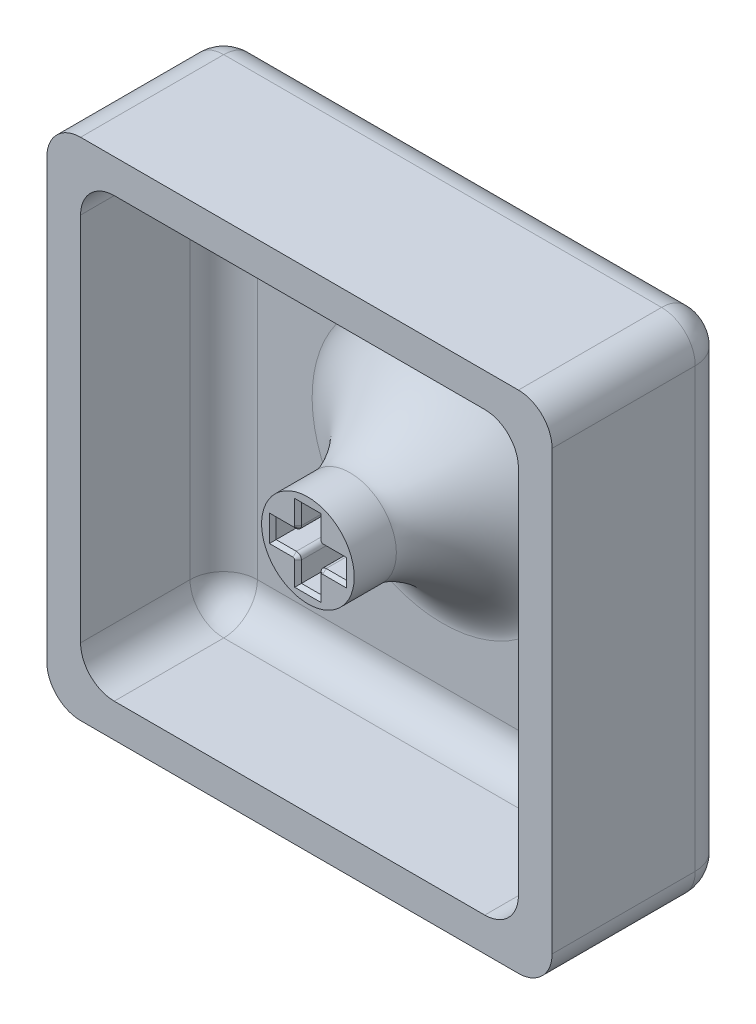
from build123d import *

# Parameters (mm, degrees)
EXTRUDE_1_DEPTH = 8.5
SKETCH_1_6_R    = 2.75
EXTRUDE_2_DEPTH = 8
EXTRUDE_START   = -2
EXTRUDE_3_DEPTH = 2
FILLET_4_R      = 0.3
FILLET_1_R      = 2
CHAMFER_1_SIZE  = 0.2
FILLET_2_R      = 2
FILLET_3_SIZE   = 5
FILLET_3_SIZE_2 = 5.5
EXTRUDE_START_2 = 4
EXTRUDE_4_DEPTH = 4


with BuildPart() as part:
    # 草图1 → 凸台-拉伸1 (new body)
    with BuildSketch(Plane.XY):
        with BuildLine():
            ThreePointArc((-15, 13), (-14.414213562, 14.414213562), (-13, 15))
            Line((-13, 15), (13, 15))
            ThreePointArc((13, 15), (14.414213562, 14.414213562), (15, 13))
            Line((15, 13), (15, -13))
            ThreePointArc((15, -13), (14.414213562, -14.414213562), (13, -15))
            Line((13, -15), (-13, -15))
            ThreePointArc((-13, -15), (-14.414213562, -14.414213562), (-15, -13))
            Line((-15, -13), (-15, 13))
        make_face()
        with BuildLine():
            ThreePointArc((-13, -11), (-12.414213562, -12.414213562), (-11, -13))
            Line((-11, -13), (11, -13))
            ThreePointArc((11, -13), (12.414213562, -12.414213562), (13, -11))
            Line((13, -11), (13, 11))
            ThreePointArc((13, 11), (12.414213562, 12.414213562), (11, 13))
            Line((11, 13), (-11, 13))
            ThreePointArc((-11, 13), (-12.414213562, 12.414213562), (-13, 11))
            Line((-13, 11), (-13, -11))
        make_face(mode=Mode.SUBTRACT)
    extrude(amount=EXTRUDE_1_DEPTH)



with BuildPart() as body_2:
    # 草图1<6> → 凸台-拉伸2 (new body)
    with BuildSketch(Plane.XY):
        Circle(SKETCH_1_6_R)
        Polygon((-2.085, -0.585), (-2.085, 0.585), (-0.585, 0.585), (-0.585, 2.085), (0.585, 2.085), (0.585, 0.585), (2.085, 0.585), (2.085, -0.585), (0.585, -0.585), (0.585, -2.085), (-0.585, -2.085), (-0.585, -0.585), align=None, mode=Mode.SUBTRACT)
    extrude(amount=EXTRUDE_2_DEPTH)


with BuildPart() as part_1:
    add(part.part)

    add(body_2.part)  # 凸台-拉伸3 merges body 2
    # 草图1<7> → 凸台-拉伸3 (add)
    with BuildSketch(Plane.XY.offset(EXTRUDE_START)):
        with BuildLine():
            Line((-13, 15), (13, 15))
            ThreePointArc((13, 15), (14.414213562, 14.414213562), (15, 13))
            Line((15, 13), (15, -13))
            ThreePointArc((15, -13), (14.414213562, -14.414213562), (13, -15))
            Line((13, -15), (-13, -15))
            ThreePointArc((-13, -15), (-14.414213562, -14.414213562), (-15, -13))
            Line((-15, -13), (-15, 13))
            ThreePointArc((-15, 13), (-14.414213562, 14.414213562), (-13, 15))
        make_face()
    extrude(amount=EXTRUDE_3_DEPTH)

    # 圆角4
    fillet_4_edges = [part_1.edges().sort_by_distance(p)[0] for p in [
        (0.585, 0.585, 4),
        (0.585, -0.585, 4),
        (-0.585, -0.585, 4),
        (-0.585, 0.585, 4),
    ]]
    fillet(fillet_4_edges, radius=FILLET_4_R)

    # 圆角1
    fillet_1_edges = [part_1.edges().sort_by_distance(p)[0] for p in [
        (-14.414213562, -14.414213562, -2),
        (-15, 0, -2),
        (14.414213562, 14.414213562, -2),
        (14.414213562, -14.414213562, -2),
        (0, -15, -2),
        (-14.414213562, 14.414213562, -2),
        (0, 15, -2),
        (15, 0, -2),
    ]]
    fillet(fillet_1_edges, radius=FILLET_1_R)

    # 倒角1
    chamfer_1_edges = [part_1.edges().sort_by_distance(p)[0] for p in [
        (1.485, 0.585, 8),
        (1.485, -0.585, 8),
        (0.585, -1.485, 8),
        (-0.585, -1.485, 8),
        (0.672867966, -0.672867966, 8),
        (-0.672867966, -0.672867966, 8),
        (0.672867966, 0.672867966, 8),
        (-0.672867966, 0.672867966, 8),
        (0, -2.085, 8),
        (-1.485, -0.585, 8),
        (-2.085, 0, 8),
        (-0.585, 1.485, 8),
        (0, 2.085, 8),
        (0.585, 1.485, 8),
        (2.085, 0, 8),
        (-1.485, 0.585, 8),
    ]]
    chamfer(chamfer_1_edges, length=CHAMFER_1_SIZE)

    # 圆角2
    fillet_2_edges = [part_1.edges().sort_by_distance(p)[0] for p in [
        (0, -13, 0),
        (12.414213562, -12.414213562, 0),
        (13, 0, 0),
        (12.414213562, 12.414213562, 0),
        (0, 13, 0),
        (-12.414213562, 12.414213562, 0),
        (-13, 0, 0),
        (-12.414213562, -12.414213562, 0),
    ]]
    fillet(fillet_2_edges, radius=FILLET_2_R)

    # 圆角3
    # a fillet whose section is not a circle: 5.5, 5 mm, written as the material it adds along each edge
    with BuildSketch(Plane(origin=(0, 0, 0), x_dir=(1, 0, 0), z_dir=(0, -1, 0))) as fillet_3_piece_1:
        with BuildLine():
            Bezier((2.75 + FILLET_3_SIZE, 0), (2.75, 0), (2.75, FILLET_3_SIZE_2), weights=[1, 0.333333333, 1])
            Line((2.75, FILLET_3_SIZE_2), (2.75, 0))
            Line((2.75, 0), (2.75 + FILLET_3_SIZE, 0))
        make_face()
    revolve(axis=Axis((0, 0, 0), (0, 0, 1)))

    # 草图3 → 凸台-拉伸4 (add)
    with BuildSketch(Plane.XY.offset(EXTRUDE_START_2)):
        with BuildLine():
            Line((0.585, 0.885), (0.585, 2.085))
            Line((0.585, 2.085), (-0.585, 2.085))
            Line((-0.585, 2.085), (-0.585, 0.885))
            ThreePointArc((-0.585, 0.885), (-0.672867966, 0.672867966), (-0.885, 0.585))
            Line((-0.885, 0.585), (-2.085, 0.585))
            Line((-2.085, 0.585), (-2.085, -0.585))
            Line((-2.085, -0.585), (-0.885, -0.585))
            ThreePointArc((-0.885, -0.585), (-0.672867966, -0.672867966), (-0.585, -0.885))
            Line((-0.585, -0.885), (-0.585, -2.085))
            Line((-0.585, -2.085), (0.585, -2.085))
            Line((0.585, -2.085), (0.585, -0.885))
            ThreePointArc((0.585, -0.885), (0.672867966, -0.672867966), (0.885, -0.585))
            Line((0.885, -0.585), (2.085, -0.585))
            Line((2.085, -0.585), (2.085, 0.585))
            Line((2.085, 0.585), (0.885, 0.585))
            ThreePointArc((0.885, 0.585), (0.672867966, 0.672867966), (0.585, 0.885))
        make_face()
    extrude(amount=-EXTRUDE_4_DEPTH)


solid = part_1.part
